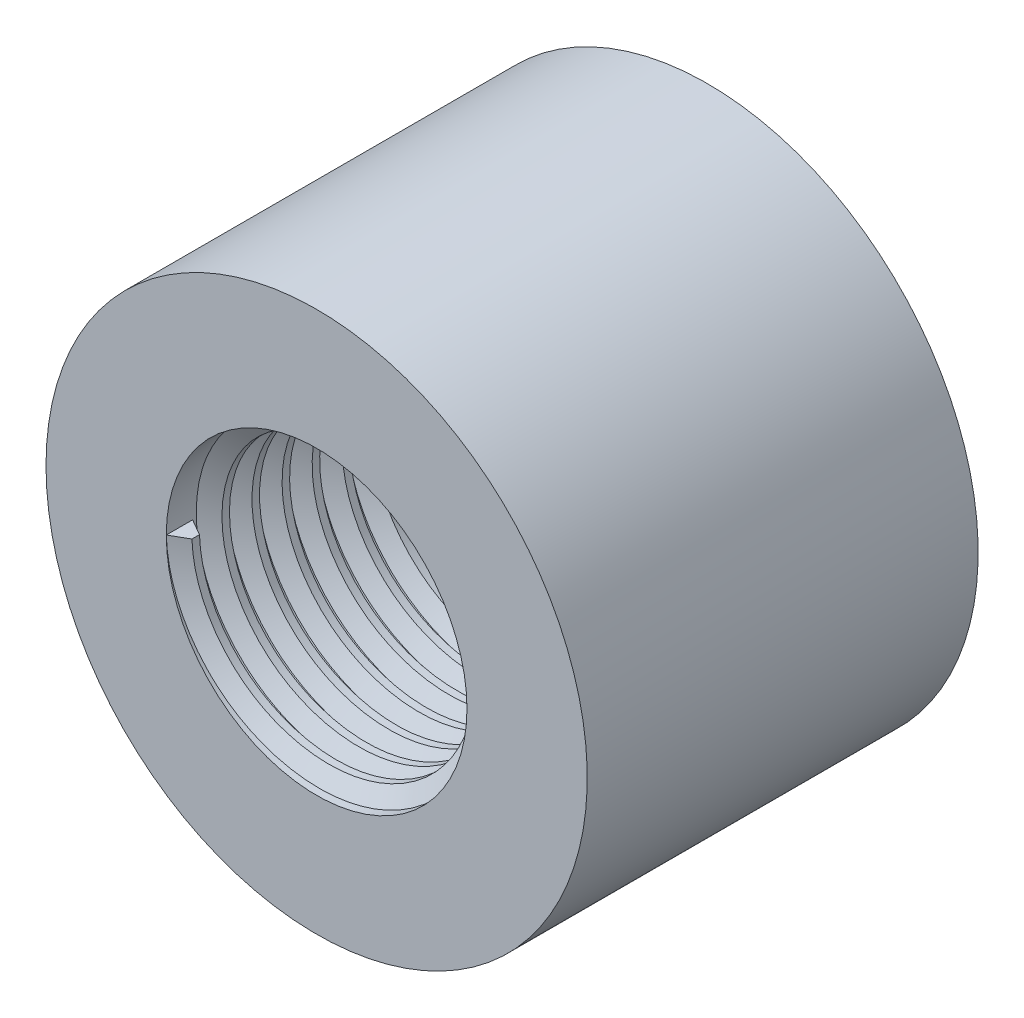
from build123d import *

# Parameters (mm, degrees)
SKETCH1_R           = 9
SKETCH1_R_2         = 5
BOSS_EXTRUDE1_DEPTH = 13
SKETCH4_R           = 7
CUT_EXTRUDE1_DEPTH  = 3
THREAD1_PITCH       = 1


with BuildPart() as part:
    # Sketch1 → Boss-Extrude1 (new body)
    with BuildSketch(Plane.XY):
        with Locations(Location((0, 0, 0), (0, 0, 180))):
            Circle(SKETCH1_R)
        with Locations(Location((0, 0, 0), (0, 0, 180))):
            Circle(SKETCH1_R_2, mode=Mode.SUBTRACT)
    extrude(amount=BOSS_EXTRUDE1_DEPTH)

    # Sketch4 → Cut-Extrude1 (cut)
    with BuildSketch(Plane(origin=(0, 0, 0), x_dir=(-1, 0, 0), z_dir=(0, 0, -1))):
        Circle(SKETCH4_R)
    extrude(amount=-CUT_EXTRUDE1_DEPTH, mode=Mode.SUBTRACT)

    # Thread1: the profile of Thread Profile2 profile screwed along a left-hand helix of 10 turns, 8 arcs to a turn; built about Z, then put on its axis
    thread1_z = Axis((0, 0, 0), (0, 0, 1))
    thread1_corners = [(5.0006, 0, -0.00034641), (5.0006, 0, 0.875346407), (4.458734125, 0, 0.562499999), (4.458734125, 0, 0.312499999)]
    with BuildLine(mode=Mode.PRIVATE) as thread1_profile:
        Line(thread1_corners[0], thread1_corners[1])
        Line(thread1_corners[1], thread1_corners[2])
        Line(thread1_corners[2], thread1_corners[3])
        Line(thread1_corners[3], thread1_corners[0])
    thread1_cap = Face(thread1_profile.wire())
    thread1_turn_angles = [0, -22.5, -45, -67.5, -90, -112.5, -135, -157.5, -180, -202.5, -225, -247.5, -270, -292.5, -315, -337.5, -360]
    thread1_turn_weights = [1, 0.9238795325112867, 1, 0.9238795325112867, 1, 0.9238795325112867, 1, 0.9238795325112867, 1, 0.9238795325112867, 1, 0.9238795325112867, 1, 0.9238795325112867, 1, 0.9238795325112867, 1]
    thread1_turn_rails = [Edge.make_bspline([Vector(p[0], p[1], 0).rotate(thread1_z, thread1_turn_angles[k]) / thread1_turn_weights[k] + Vector(0, 0, p[2] + -THREAD1_PITCH * thread1_turn_angles[k] / 360) for k in range(17)], [0, 0, 0, 1, 1, 2, 2, 3, 3, 4, 4, 5, 5, 6, 6, 7, 7, 8, 8, 8], 2, thread1_turn_weights) for p in thread1_corners]
    thread1_turn_sides = [Face.make_surface_from_curves(thread1_turn_rails[p[0]], thread1_turn_rails[p[1]]) for p in [(0, 1), (1, 2), (2, 3), (3, 0)]]
    thread1 = Plane(origin=(0, 0, 13), x_dir=(-1, 0, 0), z_dir=(0, 0, -1)) * Solid(Shell([*[p.moved(Location((0, 0, THREAD1_PITCH * i))) for i in range(10) for p in thread1_turn_sides], thread1_cap, thread1_cap.rotate(thread1_z, -3600).moved(Location((0, 0, -THREAD1_PITCH * -3600 / 360)))]))
    add(thread1)


solid = part.part
